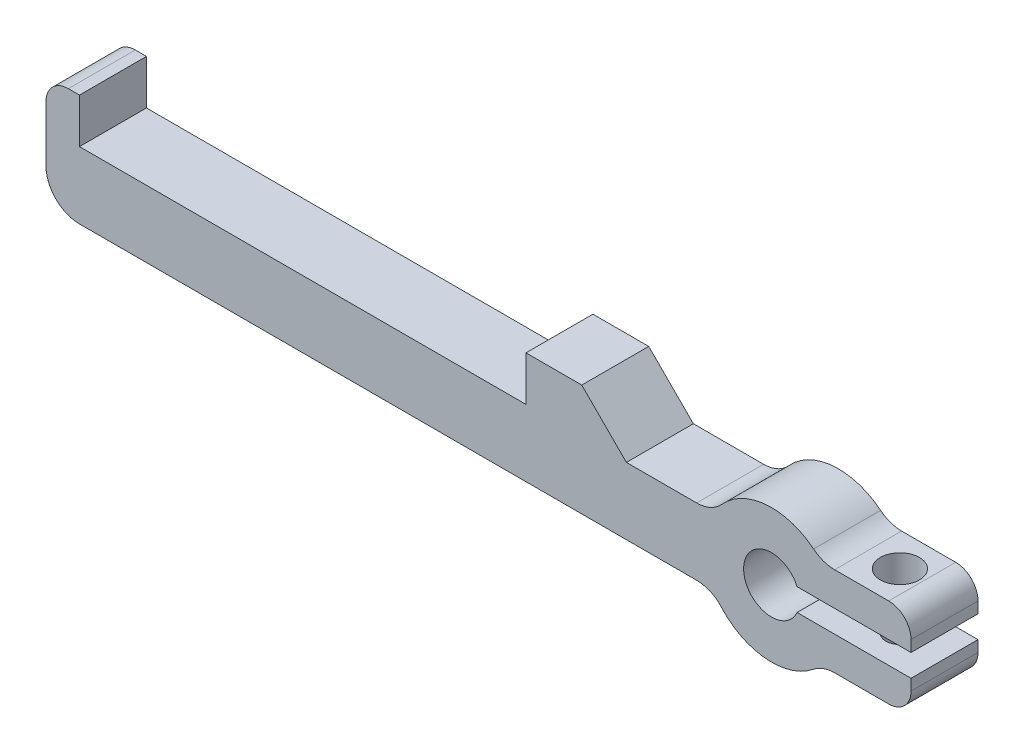
from build123d import *

# Parameters (mm, degrees)
ESQUISSE1_R                  = 6
ESQUISSE1_R_2                = 2.5
BOSS_EXTRU_1_DEPTH           = 6
ESQUISSE2_W                  = 62
ESQUISSE2_H                  = 6
BOSS_EXTRU_2_DEPTH           = 6
ESQUISSE3_W                  = 10
ESQUISSE3_H                  = 8
BOSS_EXTRU_3_DEPTH           = 6
CONG_1_R                     = 3
ENL_V_MAT_EXTRU_1_DEPTH      = 66.551506466
ENL_V_MAT_EXTRU_1_DEPTH_BACK = 66.551506466
ESQUISSE4_W                  = 12
ESQUISSE4_H                  = 2
ENL_V_MAT_EXTRU_2_DEPTH      = 67.037867924
ENL_V_MAT_EXTRU_2_DEPTH_BACK = 67.037867924
ESQUISSE5_R                  = 1.25
ESQUISSE6_R                  = 1.75
ENL_V_MAT_EXTRU_3_DEPTH      = 3
CONG_2_R                     = 2
ESQUISSE7_W                  = 3
ESQUISSE7_H                  = 4
BOSS_EXTRU_4_DEPTH           = 6
CHANFREIN1_SIZE              = 6
CONG_3_R                     = 2


with BuildPart() as part:
    # Esquisse1 → Boss.-Extru.1 (new body)
    with BuildSketch(Plane.XY):
        Circle(ESQUISSE1_R)
        Circle(ESQUISSE1_R_2, mode=Mode.SUBTRACT)
    extrude(amount=BOSS_EXTRU_1_DEPTH)

    # Esquisse2 → Boss.-Extru.2 (add)
    with BuildSketch(Plane.XY.offset(6)):
        with Locations((-34, 0)):
            Rectangle(ESQUISSE2_W, ESQUISSE2_H)
    extrude(amount=-BOSS_EXTRU_2_DEPTH)

    # Esquisse3 → Boss.-Extru.3 (add)
    with BuildSketch(Plane.XY.offset(6)):
        with Locations((7.5, 0)):
            Rectangle(ESQUISSE3_W, ESQUISSE3_H)
    extrude(amount=-BOSS_EXTRU_3_DEPTH)

    # Congé1
    cong_1_edges = [part.edges().sort_by_distance(p)[0] for p in [
        (-5.196152423, -3, 3),
        (-5.196152423, 3, 3),
        (-65, -3, 3),
        (4.472135955, -4, 3),
        (4.472135955, 4, 3),
    ]]
    fillet(cong_1_edges, radius=CONG_1_R)

    # Esquisse4 → Enlèv. mat.-Extru.1 (cut, two sides: drawn at the far end of the back side and taken through both)
    with BuildSketch(Plane.XY.offset(6).offset(-ENL_V_MAT_EXTRU_1_DEPTH_BACK)):
        with Locations((6.5, 0)):
            Rectangle(ESQUISSE4_W, ESQUISSE4_H)
    extrude(amount=ENL_V_MAT_EXTRU_1_DEPTH + ENL_V_MAT_EXTRU_1_DEPTH_BACK, mode=Mode.SUBTRACT)

    # Esquisse5 → Enlèv. mat.-Extru.2 (cut, two sides: drawn at the far end of the back side and taken through both)
    with BuildSketch(Plane(origin=(0, 4, 0), x_dir=(1, 0, 0), z_dir=(0, 1, 0)).offset(-ENL_V_MAT_EXTRU_2_DEPTH_BACK)):
        with Locations(Location((8.5, -3, 0), (0, 0, 90))):
            Circle(ESQUISSE5_R)
    extrude(amount=ENL_V_MAT_EXTRU_2_DEPTH + ENL_V_MAT_EXTRU_2_DEPTH_BACK, mode=Mode.SUBTRACT)

    # Esquisse6 → Enlèv. mat.-Extru.3 (cut)
    with BuildSketch(Plane(origin=(0, 4, 0), x_dir=(1, 0, 0), z_dir=(0, 1, 0))):
        with Locations(Location((8.5, -3, 0), (0, 0, 180))):
            Circle(ESQUISSE6_R)
    extrude(amount=-ENL_V_MAT_EXTRU_3_DEPTH, mode=Mode.SUBTRACT)

    # Congé2
    cong_2_edges = [part.edges().sort_by_distance(p)[0] for p in [
        (12.5, -4, 3),
        (12.5, 4, 3),
    ]]
    fillet(cong_2_edges, radius=CONG_2_R)

    # Esquisse7 → Boss.-Extru.4 (add)
    with BuildSketch(Plane.XY.offset(6)):
        with Locations((-63.5, 5)):
            Rectangle(ESQUISSE7_W, ESQUISSE7_H)
        with Locations((-20.5, 5)):
            Rectangle(ESQUISSE7_W, ESQUISSE7_H)
    extrude(amount=-BOSS_EXTRU_4_DEPTH)

    # Chanfrein1
    # the kernel refuses this chamfer: 6 mm, written as the material it adds along each edge
    with BuildSketch(Plane(origin=(-19, 3, 6), x_dir=(-0.027495876610586202, 0.9996219169112968, 0), z_dir=(0, 0, -1))) as chanfrein1_piece_1_section:
        Polygon((CHANFREIN1_SIZE * 0.999621916911, CHANFREIN1_SIZE * 0.0274958766106), (-CHANFREIN1_SIZE * 0.0274958766106, CHANFREIN1_SIZE * 0.999621916911), (0, 0), align=None)
    chanfrein1_piece_1 = extrude(amount=6, mode=Mode.PRIVATE)
    chanfrein1_piece_1 = split(chanfrein1_piece_1, bisect_by=Plane(origin=(-16.81581799, 7, 3), z_dir=(0, -1, 0)), keep=Keep.TOP, mode=Mode.PRIVATE)
    add(chanfrein1_piece_1)

    # Congé3
    cong_3_edges = [part.edges().sort_by_distance(p)[0] for p in [
        (-65, 7, 3),
    ]]
    fillet(cong_3_edges, radius=CONG_3_R)


solid = part.part
